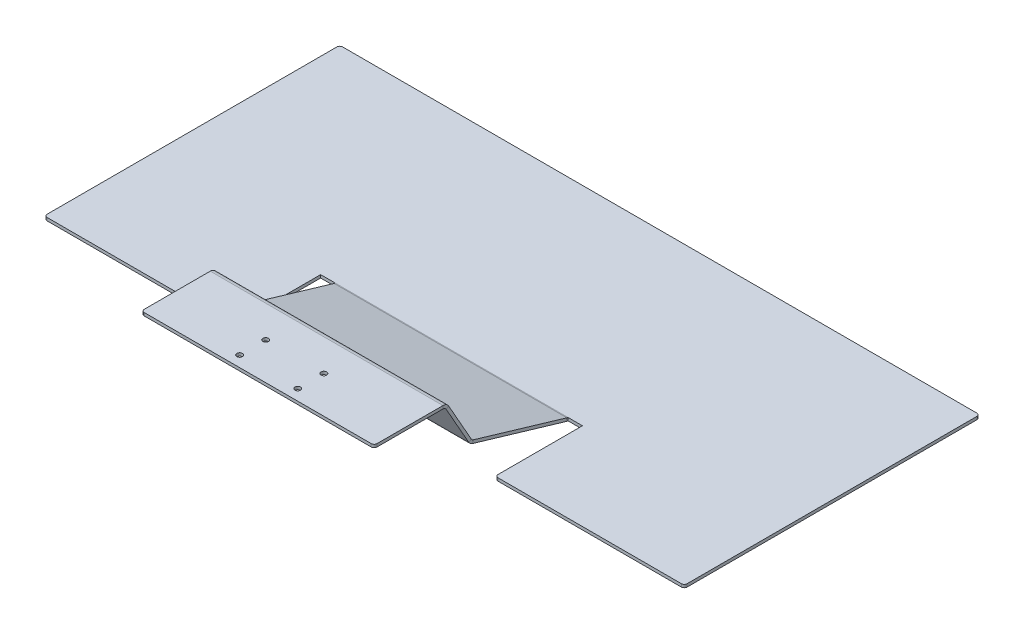
from build123d import *

# Parameters (mm, degrees)
BASE_FLANGE1_DEPTH           = 203.2
SKETCH2_W                    = 196.85
SKETCH2_H                    = 181.790367069
BOSS_EXTRUDE1_DEPTH          = 2.58826
F_10_0_1935_DIAMETER_HOLE1_D = 4.9149
SKETCH16_W                   = 184.15
SKETCH16_H                   = 76.2
BOSS_EXTRUDE2_DEPTH          = 2.58826
SKETCH17_W                   = 19.05
SKETCH17_H                   = 257.990367069
CUT_EXTRUDE1_DEPTH           = 537.279077243
FILLET1_R                    = 2.54


# Sheet-metal steps are written as plain solids
with BuildPart() as part:
    # Sketch1 → Base-Flange1 (new body)
    with BuildSketch(Plane(origin=(0, 0, 0), x_dir=(0, 0, -1), z_dir=(1, 0, 0))):
        with BuildLine():
            Line((0, 0), (-181.790367069, 0))
            ThreePointArc((-181.790367069, 0), (-182.617352358, 0.059641748), (-183.427221345, 0.237332575))
            Line((-183.427221345, 0.237332575), (-265.029897441, 24.40914646))
            ThreePointArc((-265.029897441, 24.40914646), (-266.980756871, 25.424699599), (-268.409129334, 27.097108878))
            Line((-268.409129334, 27.097108878), (-288.093120118, 61.888444803))
            ThreePointArc((-288.093120118, 61.888444803), (-289.257017075, 63.067677729), (-290.856499452, 63.5))
            Line((-290.856499452, 63.5), (-350.980894178, 63.5))
            Line((-350.980894178, 63.5), (-350.980894178, 66.08826))
            Line((-350.980894178, 66.08826), (-290.856499452, 66.08826))
            ThreePointArc((-290.856499452, 66.08826), (-287.953119041, 65.303508614), (-285.840413284, 63.162965007))
            Line((-285.840413284, 63.162965007), (-266.156422501, 28.371629081))
            ThreePointArc((-266.156422501, 28.371629081), (-265.369527137, 27.450292987), (-264.294791885, 26.890821227))
            Line((-264.294791885, 26.890821227), (-182.692115789, 2.719007342))
            ThreePointArc((-182.692115789, 2.719007342), (-182.245956144, 2.621116847), (-181.790367069, 2.58826))
            Line((-181.790367069, 2.58826), (0, 2.58826))
            Line((0, 2.58826), (0, 0))
        make_face()
    extrude(amount=BASE_FLANGE1_DEPTH)

    # Sketch2 → Boss-Extrude1 (add)
    with BuildSketch(Plane(origin=(0, 2.58826, 0), x_dir=(1, 0, 0), z_dir=(0, 1, 0))):
        with Locations((-98.425, -90.895183535)):
            Rectangle(SKETCH2_W, SKETCH2_H)
        with Locations((301.625, -90.895183535)):
            Rectangle(SKETCH2_W, SKETCH2_H)
    extrude(amount=-BOSS_EXTRUDE1_DEPTH)

    # #10 (0.1935) Diameter Hole1 (through all)
    with Locations(Plane(origin=(0, 66.08826, 0), x_dir=(1, 0, 0), z_dir=(0, 1, 0))):
        with Locations((76.2, -341.455894178), (76.2, -318.646694178), (127, -318.646694178), (127, -341.455894178)):
            Hole(F_10_0_1935_DIAMETER_HOLE1_D / 2)

    # Sketch16 → Boss-Extrude2 (add)
    with BuildSketch(Plane(origin=(0, 2.58826, 0), x_dir=(1, 0, 0), z_dir=(0, 1, 0))):
        with Locations((-104.775, -219.890367069)):
            Rectangle(SKETCH16_W, SKETCH16_H)
        with Locations((307.975, -219.890367069)):
            Rectangle(SKETCH16_W, SKETCH16_H)
    extrude(amount=-BOSS_EXTRUDE2_DEPTH)

    # Sketch17 → Cut-Extrude1 (cut, through all)
    with BuildSketch(Plane.XZ):
        with Locations((-187.325, 128.995183535)):
            Rectangle(SKETCH17_W, SKETCH17_H)
        with Locations((390.525, 128.995183535)):
            Rectangle(SKETCH17_W, SKETCH17_H)
    extrude(amount=-CUT_EXTRUDE1_DEPTH, mode=Mode.SUBTRACT)

    # Fillet1
    fillet1_edges = [part.edges().sort_by_distance(p)[0] for p in [
        (-12.7, 1.29413, 257.990367069),
        (215.9, 1.29413, 257.990367069),
        (381, 1.29413, 257.990367069),
        (-177.8, 1.29413, 257.990367069),
        (-177.8, 1.29413, 0),
        (381, 1.29413, 0),
        (0, 64.79413, 350.980894178),
        (203.2, 64.79413, 350.980894178),
    ]]
    fillet(fillet1_edges, radius=FILLET1_R)


solid = part.part
